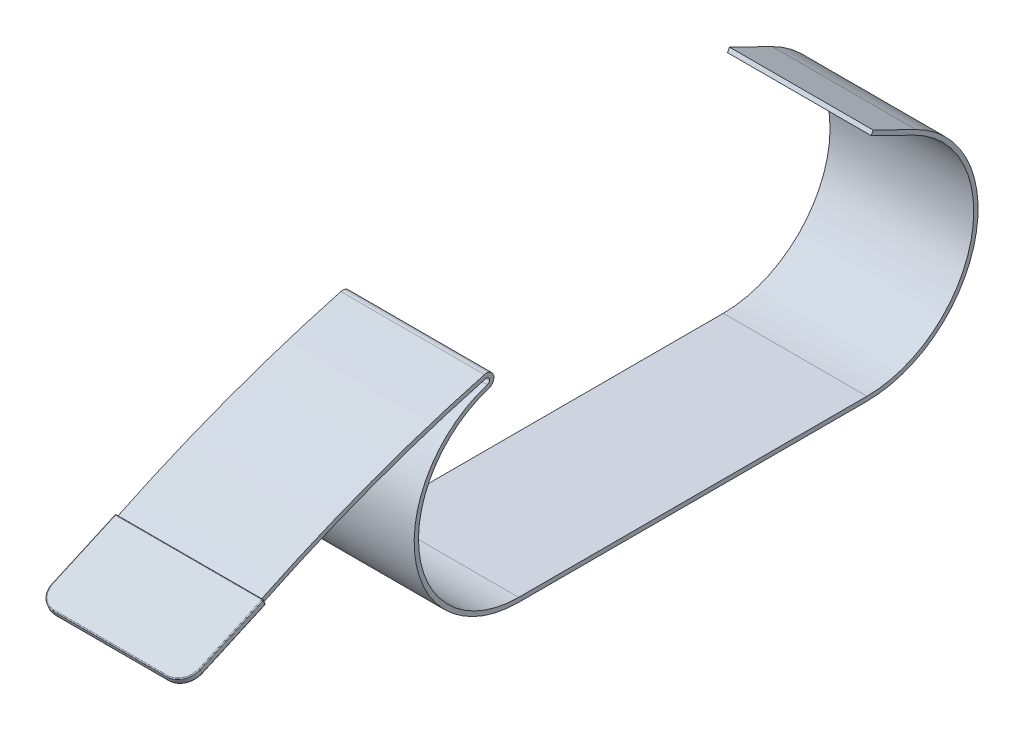
from build123d import *

# Parameters (mm, degrees)
BOSS_EXTRUDE1_DEPTH = 8.25
BOSS_EXTRUDE2_DEPTH = 8.5
FILLET2_R           = 2
CUT_EXTRUDE1_DEPTH  = 0.1
FILLET1_R           = 0.1


with BuildPart() as part:
    # Sketch1 → Boss-Extrude1 (new, symmetric)
    with BuildSketch(Plane(origin=(0, 0, 0), x_dir=(0, 0, -1), z_dir=(1, 0, 0))):
        with BuildLine():
            Line((-20, 0), (20, 0))
            ThreePointArc((20, 0), (31.94314613143427, 9.491936676512388), (25.392516821689124, 23.269630860737195))
            Line((25.392516821689124, 23.269630860737195), (20.48767915496346, 25.67194333522964))
            Line((20.48767915496346, 25.67194333522964), (20.707608671089492, 26.12097675039667))
            Line((20.707608671089492, 26.12097675039667), (25.612446337815154, 23.71866427590423))
            ThreePointArc((25.612446337815154, 23.71866427590423), (32.4302378618011, 9.379057775878826), (20, -0.5))
            Line((20, -0.5), (-20, -0.4999999999999987))
            ThreePointArc((-20, -0.4999999999999987), (-31.863566841643475, 9.685729623859952), (-23.590234900340555, 22.953935409328388))
            ThreePointArc((-23.590234900340555, 22.953935409328388), (-23.354479596787012, 23.394160454012642), (-23.789870300203464, 23.638728621400347))
            ThreePointArc((-23.789870300203464, 23.638728621400347), (-36.8961810366091, 19.4394741124151), (-49.55557214404263, 14.040498622612501))
            Line((-49.55557214404263, 14.040498622612501), (-49.77289846768594, 14.4907977110545))
            ThreePointArc((-49.77289846768594, 14.4907977110545), (-37.070723460551015, 19.908019672894), (-23.920118407045663, 24.1214660558966))
            ThreePointArc((-23.920118407045663, 24.1214660558966), (-22.874461521184195, 23.534098465627046), (-23.440663680772627, 22.47683117514367))
            ThreePointArc((-23.440663680772627, 22.47683117514367), (-31.36932392713061, 9.761386358218672), (-20, 0))
        make_face()
    extrude(amount=BOSS_EXTRUDE1_DEPTH, both=True)

    # Sketch2 → Boss-Extrude2 (add, symmetric)
    with BuildSketch(Plane(origin=(0, 0, 0), x_dir=(0, 0, -1), z_dir=(1, 0, 0))):
        Polygon((-49.26537752455312, 14.066353693944993), (-58.392962295280306, 9.981357212528026), (-58.67891204897949, 10.620288146478929), (-49.5513272782523, 14.705284627895898), align=None)
    extrude(amount=BOSS_EXTRUDE2_DEPTH, both=True)

    # Fillet2
    fillet2_edges = [part.edges().sort_by_distance(p)[0] for p in [
        (-8.5, 10.300822679503478, 58.5359371721299),
        (8.5, 10.300822679503478, 58.5359371721299),
    ]]
    fillet(fillet2_edges, radius=FILLET2_R)

    # Sketch3 → Cut-Extrude1 (cut)
    with BuildSketch(Plane(origin=(0, 30.088237033082944, 13.465812205476922), x_dir=(1, 0, 0), z_dir=(0, -0.9127584770727193, -0.40849964814169676))):
        with BuildLine():
            Line((-6.1992171672518035, 48.336758954326044), (6.1992171672518035, 48.336758954326044))
            ThreePointArc((6.1992171672518035, 48.336758954326044), (6.9063239484383585, 48.04386573551259), (7.199217167251811, 47.33675895432604))
            Line((7.199217167251811, 47.33675895432604), (7.199217167251811, 44.50945894575458))
            ThreePointArc((7.199217167251811, 44.50945894575458), (6.9063239484383585, 43.80235216456803), (6.1992171672518035, 43.509458945754574))
            Line((6.1992171672518035, 43.509458945754574), (-6.1992171672518035, 43.509458945754574))
            ThreePointArc((-6.1992171672518035, 43.509458945754574), (-6.9063239484383585, 43.80235216456803), (-7.199217167251811, 44.50945894575458))
            Line((-7.199217167251811, 44.50945894575458), (-7.199217167251811, 47.33675895432604))
            ThreePointArc((-7.199217167251811, 47.33675895432604), (-6.906323948438358, 48.04386573551259), (-6.1992171672518035, 48.336758954326044))
        make_face()
    extrude(amount=-CUT_EXTRUDE1_DEPTH, mode=Mode.SUBTRACT)

    # Fillet1
    # the kernel refuses this fillet: 0.1 mm, written as the material it takes off along each edge
    with BuildSketch(Plane(origin=(-8.4, 14.573158815374455, 49.601753161145396), x_dir=(-1, 0, 0), z_dir=(0, 0.9127584770727193, 0.40849964814169704))) as fillet1_piece_1_section:
        Polygon((0, 0), (FILLET1_R * 1.02, 0), (FILLET1_R * 1.02, -FILLET1_R * 1.02), (0, -FILLET1_R * 1.02), align=None)
    fillet1_piece_1 = extrude(amount=FILLET1_R * 1.02, mode=Mode.PRIVATE)
    fillet1_piece_1 = fillet1_piece_1 - Plane(origin=(-8.4, 14.573158815374455, 49.601753161145396), x_dir=(0.7071067811865475, -0.28885287131331006, 0.6454177087236268), z_dir=(0, 0.9127584770727193, 0.40849964814169704)) * Sphere(FILLET1_R, mode=Mode.PRIVATE)
    add(fillet1_piece_1, mode=Mode.SUBTRACT)
    with BuildSketch(Plane(origin=(-8.4, 14.116779576838097, 49.39750333707456), x_dir=(0, 0.4084996481416934, -0.912758477072721), z_dir=(-1, 0, 0))) as fillet1_piece_2_section:
        Polygon((0, 0), (FILLET1_R * 1.02, 0), (FILLET1_R * 1.02, FILLET1_R * 1.02), (3.9e-16, FILLET1_R * 1.02), align=None)
    fillet1_piece_2 = extrude(amount=FILLET1_R * 1.02, mode=Mode.PRIVATE)
    fillet1_piece_2 = fillet1_piece_2 - Plane(origin=(-8.4, 14.116779576838097, 49.39750333707456), x_dir=(0, 0.35656483741031497, 0.9342705800369375), z_dir=(-1, 0, 0)) * Sphere(FILLET1_R, mode=Mode.PRIVATE)
    add(fillet1_piece_2, mode=Mode.SUBTRACT)
    with BuildSketch(Plane(origin=(8.4, 14.116779576838095, 49.39750333707456), x_dir=(1, 0, 0), z_dir=(0, 0.4084996481416934, -0.912758477072721))) as fillet1_piece_3_section:
        Polygon((0, 0), (FILLET1_R * 1.02, 0), (FILLET1_R * 1.02, FILLET1_R * 1.02), (0, FILLET1_R * 1.02), align=None)
    fillet1_piece_3 = extrude(amount=FILLET1_R * 1.02, mode=Mode.PRIVATE)
    fillet1_piece_3 = fillet1_piece_3 - Plane(origin=(8.4, 14.116779576838095, 49.39750333707456), x_dir=(-0.7071067811865475, 0.6454177087236256, 0.2888528713133125), z_dir=(0, 0.4084996481416934, -0.912758477072721)) * Sphere(FILLET1_R, mode=Mode.PRIVATE)
    add(fillet1_piece_3, mode=Mode.SUBTRACT)
    with BuildSketch(Plane(origin=(8.4, 14.573158815374455, 49.601753161145396), x_dir=(0, 0.4084996481416934, -0.912758477072721), z_dir=(0, 0.9127584770727193, 0.40849964814169704))) as fillet1_piece_4_section:
        Polygon((0, 0), (FILLET1_R * 1.02, 0), (FILLET1_R * 1.02, -FILLET1_R * 1.02), (0, -FILLET1_R * 1.02), align=None)
    fillet1_piece_4 = extrude(amount=FILLET1_R * 1.02, mode=Mode.PRIVATE)
    fillet1_piece_4 = fillet1_piece_4 - Plane(origin=(8.4, 14.573158815374455, 49.601753161145396), x_dir=(-0.7071067811865475, -0.28885287131331006, 0.6454177087236268), z_dir=(0, 0.9127584770727193, 0.40849964814169704)) * Sphere(FILLET1_R, mode=Mode.PRIVATE)
    add(fillet1_piece_4, mode=Mode.SUBTRACT)
    with BuildSketch(Plane(origin=(-8.5, 11.43728744276232, 56.853395094834056), x_dir=(1, 0, 0), z_dir=(0, 0.40849964814169704, -0.9127584770727193))) as fillet1_piece_5:
        with BuildLine():
            CenterArc((FILLET1_R, FILLET1_R), FILLET1_R, 180, 90)
            Line((0, FILLET1_R), (0, 0))
            Line((0, 0), (FILLET1_R, 0))
        make_face()
    extrude(amount=7.900000000000008, mode=Mode.SUBTRACT)
    with BuildSketch(Plane(origin=(-8.5, 14.025503729130824, 49.35665337226039), x_dir=(0, 0.9127584770727193, 0.40849964814169687), z_dir=(0, -0.40849964814169687, 0.9127584770727193))) as fillet1_piece_6:
        with BuildLine():
            CenterArc((FILLET1_R, -FILLET1_R), FILLET1_R, 90, 90)
            Line((0, -FILLET1_R), (0, 0))
            Line((0, 0), (FILLET1_R, 0))
        make_face()
    extrude(amount=7.9, mode=Mode.SUBTRACT)
    with BuildSketch(Plane(origin=(-8.5, 14.614008780188621, 49.51047731343813), x_dir=(0, -0.40849964814169337, 0.9127584770727208), z_dir=(0, -0.912758477072721, -0.4084996481416934))) as fillet1_piece_7:
        with BuildLine():
            CenterArc((FILLET1_R, -FILLET1_R), FILLET1_R, 90, 90)
            Line((1.45e-15, -FILLET1_R), (0, 0))
            Line((0, 0), (FILLET1_R, 0))
        make_face()
    extrude(amount=0.4999999999999936, mode=Mode.SUBTRACT)
    with BuildSketch(Plane(origin=(6.5, 10.620288146478929, 58.67891204897949), x_dir=(0, 0.4084996481416779, -0.9127584770727277), z_dir=(-1, 0, 0))) as fillet1_piece_8:
        with BuildLine():
            CenterArc((FILLET1_R, FILLET1_R), FILLET1_R, 179.99999999999815, 89.99999999999955)
            Line((2.51e-15, FILLET1_R), (0, 0))
            Line((0, 0), (FILLET1_R, 0))
        make_face()
    extrude(amount=13, mode=Mode.SUBTRACT)
    with BuildSketch(Plane(origin=(6.5, 9.981357212528026, 58.392962295280306), x_dir=(0, 0.9127584770727145, 0.40849964814170747), z_dir=(-1, 0, 0))) as fillet1_piece_9:
        with BuildLine():
            CenterArc((FILLET1_R, FILLET1_R), FILLET1_R, 179.9999999999996, 90.00000000000131)
            Line((0, FILLET1_R), (0, 0))
            Line((0, 0), (FILLET1_R, 0))
        make_face()
    extrude(amount=13, mode=Mode.SUBTRACT)
    with BuildSketch(Plane(origin=(8.5, 14.025503729130824, 49.35665337226039), x_dir=(0, 0.9127584770727193, 0.40849964814169687), z_dir=(0, -0.40849964814169687, 0.9127584770727193))) as fillet1_piece_10:
        with BuildLine():
            CenterArc((FILLET1_R, FILLET1_R), FILLET1_R, 180, 90)
            Line((0, FILLET1_R), (0, 0))
            Line((0, 0), (FILLET1_R, 0))
        make_face()
    extrude(amount=7.9, mode=Mode.SUBTRACT)
    with BuildSketch(Plane(origin=(8.5, 11.43728744276232, 56.853395094834056), x_dir=(-1, 0, 0), z_dir=(0, 0.40849964814169704, -0.9127584770727193))) as fillet1_piece_11:
        with BuildLine():
            CenterArc((FILLET1_R, -FILLET1_R), FILLET1_R, 90, 90)
            Line((0, -FILLET1_R), (0, 0))
            Line((0, 0), (FILLET1_R, 0))
        make_face()
    extrude(amount=7.900000000000008, mode=Mode.SUBTRACT)
    with BuildSketch(Plane(origin=(8.5, 14.614008780188621, 49.51047731343813), x_dir=(-1, -5.93e-15, 1.325e-14), z_dir=(0, -0.912758477072721, -0.4084996481416934))) as fillet1_piece_12:
        with BuildLine():
            CenterArc((FILLET1_R, -FILLET1_R), FILLET1_R, 90.00000000000082, 89.99999999999918)
            Line((1.45e-15, -FILLET1_R), (0, 0))
            Line((0, 0), (FILLET1_R, 0))
        make_face()
    extrude(amount=0.499999999999992, mode=Mode.SUBTRACT)
    with BuildSketch(Plane(origin=(-8.4, 14.066353693944993, 49.26537752455312), x_dir=(0, 0.9127584770727116, 0.40849964814171413), z_dir=(1, 0, 0))) as fillet1_piece_13:
        with BuildLine():
            CenterArc((FILLET1_R, FILLET1_R), FILLET1_R, 180, 89.99999999999864)
            Line((2.35e-15, FILLET1_R), (0, 0))
            Line((0, 0), (FILLET1_R, 0))
        make_face()
    extrude(amount=16.799999999999997, mode=Mode.SUBTRACT)
    with BuildSketch(Plane(origin=(-8.4, 14.705284627895898, 49.5513272782523), x_dir=(0, -0.40849964814173395, 0.9127584770727026), z_dir=(1, 0, 0))) as fillet1_piece_14_section:
        with BuildLine():
            CenterArc((FILLET1_R, FILLET1_R), FILLET1_R, 179.99999999999554, 90.00000000000318)
            Line((-2.13e-15, FILLET1_R), (0, 0))
            Line((0, 0), (FILLET1_R, 0))
        make_face()
    fillet1_piece_14 = extrude(amount=16.799999999999997, mode=Mode.PRIVATE)
    fillet1_piece_14 = fillet1_piece_14 - Plane(origin=(-8.325000000000001, -119.19916199032235, -14.749433901316772), x_dir=(0, 0.9005981768840285, 0.4346526472865017), z_dir=(1, 0, 0)) * Cylinder(148.4457365480458, 35, mode=Mode.PRIVATE)
    add(fillet1_piece_14, mode=Mode.SUBTRACT)
    with BuildSketch(Plane(origin=(-8.4, 14.705284627895898, 49.5513272782523), x_dir=(0, -0.40849964814173395, 0.9127584770727026), z_dir=(1, 0, 0))) as fillet1_piece_15_section:
        with BuildLine():
            CenterArc((FILLET1_R, FILLET1_R), FILLET1_R, 179.99999999999554, 90.00000000000318)
            Line((-2.13e-15, FILLET1_R), (0, 0))
            Line((0, 0), (FILLET1_R, 0))
        make_face()
    fillet1_piece_15 = extrude(amount=16.799999999999997, mode=Mode.PRIVATE)
    fillet1_piece_15 = split(fillet1_piece_15, bisect_by=Plane(origin=(-8.25, 14.615931564484248, 49.51135087212141), z_dir=(-1, 0, 0)), keep=Keep.TOP, mode=Mode.PRIVATE)
    add(fillet1_piece_15, mode=Mode.SUBTRACT)
    with BuildSketch(Plane(origin=(-8.4, 14.705284627895898, 49.5513272782523), x_dir=(0, -0.40849964814173395, 0.9127584770727026), z_dir=(1, 0, 0))) as fillet1_piece_16_section:
        with BuildLine():
            CenterArc((FILLET1_R, FILLET1_R), FILLET1_R, 179.99999999999554, 90.00000000000318)
            Line((-2.13e-15, FILLET1_R), (0, 0))
            Line((0, 0), (FILLET1_R, 0))
        make_face()
    fillet1_piece_16 = extrude(amount=16.799999999999997, mode=Mode.PRIVATE)
    fillet1_piece_16 = split(fillet1_piece_16, bisect_by=Plane(origin=(8.25, 14.615931564484251, 49.51135087212142), z_dir=(1, 0, 0)), keep=Keep.TOP, mode=Mode.PRIVATE)
    add(fillet1_piece_16, mode=Mode.SUBTRACT)
    with BuildSketch(Plane(origin=(-6.5, 10.79835650881142, 56.56744534113487), x_dir=(-1, 0, 0), z_dir=(0, 0.40849964814169437, -0.9127584770727205))) as fillet1_piece_17:
        with BuildLine():
            CenterArc((2 - FILLET1_R, FILLET1_R), FILLET1_R, 270, 90)
            Line((2 - FILLET1_R, -4.52e-15), (2, 0))
            Line((2, 0), (2, FILLET1_R))
        make_face()
    revolve(axis=Axis((-6.5, 10.79835650881142, 56.56744534113487), (0, 0.9127584770727205, 0.40849964814169437)), revolution_arc=89.99999999999994, mode=Mode.SUBTRACT)
    with BuildSketch(Plane(origin=(6.5, 10.79835650881142, 56.56744534113487), x_dir=(1, 0, 0), z_dir=(0, 0.40849964814169437, -0.9127584770727205))) as fillet1_piece_18:
        with BuildLine():
            CenterArc((2 - FILLET1_R, -FILLET1_R), FILLET1_R, 0, 90)
            Line((2 - FILLET1_R, 4.52e-15), (2, 0))
            Line((2, 0), (2, -FILLET1_R))
        make_face()
    revolve(axis=Axis((6.5, 10.79835650881142, 56.56744534113487), (0, -0.9127584770727205, -0.40849964814169437)), revolution_arc=89.99999999999994, mode=Mode.SUBTRACT)
    with BuildSketch(Plane(origin=(-6.5, 11.437287442762319, 56.853395094834056), x_dir=(-1, 0, 0), z_dir=(0, 0.40849964814169437, -0.9127584770727205))) as fillet1_piece_19:
        with BuildLine():
            CenterArc((2 - FILLET1_R, -FILLET1_R), FILLET1_R, 359.99999999999835, 90.00000000000165)
            Line((2, -FILLET1_R), (2, 0))
            Line((2, 0), (2 - FILLET1_R, 1.62e-15))
        make_face()
    revolve(axis=Axis((-6.5, 11.437287442762319, 56.853395094834056), (0, 0.9127584770727205, 0.40849964814169437)), revolution_arc=90, mode=Mode.SUBTRACT)
    with BuildSketch(Plane(origin=(6.5, 11.437287442762319, 56.853395094834056), x_dir=(1, 0, 0), z_dir=(0, 0.40849964814169437, -0.9127584770727205))) as fillet1_piece_20:
        with BuildLine():
            CenterArc((2 - FILLET1_R, FILLET1_R), FILLET1_R, 270, 90.00000000000166)
            Line((2, FILLET1_R), (2, 0))
            Line((2, 0), (2 - FILLET1_R, -1.62e-15))
        make_face()
    revolve(axis=Axis((6.5, 11.437287442762319, 56.853395094834056), (0, -0.9127584770727205, -0.40849964814169437)), revolution_arc=90, mode=Mode.SUBTRACT)
    with BuildSketch(Plane(origin=(7.199217167251811, 10.751187656072442, 56.67284021818597), x_dir=(1, -1.3009e-13, -5.822e-14), z_dir=(0, 0.4084996481416968, -0.9127584770727194))) as fillet1_piece_21:
        with BuildLine():
            CenterArc((FILLET1_R, -FILLET1_R), FILLET1_R, 89.99999999999183, 90.00000000000465)
            Line((-1.425e-14, -FILLET1_R), (0, 0))
            Line((0, 0), (FILLET1_R, 0))
        make_face()
    extrude(amount=2.827300008571454, mode=Mode.SUBTRACT)
    with BuildSketch(Plane(origin=(6.199217167251807, 11.9061387147649, 54.092198168134594), x_dir=(1, -3.55e-15, 7.11e-15), z_dir=(-7.936821341612911e-15, -0.4084996481416968, 0.9127584770727194))) as fillet1_piece_22:
        with BuildLine():
            CenterArc((1.0000000000000018 + FILLET1_R, FILLET1_R), FILLET1_R, 179.99999999999, 90.00000000001)
            Line((1.0000000000000018, FILLET1_R), (1.0000000000000018, 0))
            Line((1.0000000000000018, 0), (1.0000000000000018 + FILLET1_R, -1.422e-14))
        make_face()
    revolve(axis=Axis((6.199217167251807, 11.9061387147649, 54.092198168134594), (0, 0.9127584770727194, 0.4084996481416968)), revolution_arc=90.00000000000061, mode=Mode.SUBTRACT)
    with BuildSketch(Plane(origin=(6.1992171672518035, 12.3146383629066, 53.17943969106187), x_dir=(0, 0.4084996481415774, -0.9127584770727728), z_dir=(-1, 0, 0))) as fillet1_piece_23:
        with BuildLine():
            CenterArc((FILLET1_R, -FILLET1_R), FILLET1_R, 89.99999999999143, 90.00000000001319)
            Line((-1.135e-14, -FILLET1_R), (0, 0))
            Line((0, 0), (FILLET1_R, 0))
        make_face()
    extrude(amount=12.398434334503607, mode=Mode.SUBTRACT)
    with BuildSketch(Plane(origin=(-6.199217167251807, 11.9061387147649, 54.092198168134594), x_dir=(3.5527136788004915e-15, 0.40849964814169826, -0.9127584770727186), z_dir=(1, -1.45e-15, 3.24e-15))) as fillet1_piece_24:
        with BuildLine():
            CenterArc((1.0000000000000027 + FILLET1_R, FILLET1_R), FILLET1_R, 179.9999999999887, 90.00000000001234)
            Line((1.0000000000000038, FILLET1_R), (1.0000000000000027, 0))
            Line((1.0000000000000027, 0), (1.0000000000000027 + FILLET1_R, -1.323e-14))
        make_face()
    revolve(axis=Axis((-6.199217167251807, 11.9061387147649, 54.092198168134594), (0, 0.9127584770727194, 0.4084996481416968)), revolution_arc=90.00000000000061, mode=Mode.SUBTRACT)
    with BuildSketch(Plane(origin=(-7.199217167251811, 11.906138714764896, 54.0921981681346), x_dir=(-1, -1.3009e-13, -5.822e-14), z_dir=(0, -0.4084996481416968, 0.9127584770727194))) as fillet1_piece_25:
        with BuildLine():
            CenterArc((FILLET1_R, -FILLET1_R), FILLET1_R, 89.99999999999183, 90.0000000000091)
            Line((-1.425e-14, -FILLET1_R), (0, 0))
            Line((0, 0), (FILLET1_R, 0))
        make_face()
    extrude(amount=2.827300008571454, mode=Mode.SUBTRACT)
    with BuildSketch(Plane(origin=(-6.199217167251806, 10.751187656072442, 56.67284021818597), x_dir=(-1, 0, 0), z_dir=(0, 0.4084996481416968, -0.9127584770727194))) as fillet1_piece_26:
        with BuildLine():
            CenterArc((1.0000000000000062 + FILLET1_R, FILLET1_R), FILLET1_R, 179.99999999999537, 90.00000000000466)
            Line((1.0000000000000062, FILLET1_R), (1.0000000000000062, 0))
            Line((1.0000000000000062, 0), (1.0000000000000062 + FILLET1_R, -1.425e-14))
        make_face()
    revolve(axis=Axis((-6.199217167251806, 10.751187656072442, 56.67284021818597), (0, 0.9127584770727194, 0.4084996481416968)), revolution_arc=90.00000000000016, mode=Mode.SUBTRACT)
    with BuildSketch(Plane(origin=(-6.1992171672518035, 10.342688007930743, 57.585598695258696), x_dir=(0, -0.40849964814183753, 0.9127584770726563), z_dir=(1, 0, 0))) as fillet1_piece_27:
        with BuildLine():
            CenterArc((FILLET1_R, -FILLET1_R), FILLET1_R, 89.99999999999226, 90.00000000001148)
            Line((-1.642e-14, -FILLET1_R), (0, 0))
            Line((0, 0), (FILLET1_R, 0))
        make_face()
    extrude(amount=12.398434334503607, mode=Mode.SUBTRACT)
    with BuildSketch(Plane(origin=(6.199217167251807, 10.751187656072439, 56.672840218185975), x_dir=(-3.552713678800497e-15, -0.40849964814169537, 0.9127584770727201), z_dir=(-1, 1.45e-15, -3.24e-15))) as fillet1_piece_28:
        with BuildLine():
            CenterArc((1.0000000000000013 + FILLET1_R, FILLET1_R), FILLET1_R, 179.99999999998826, 90.00000000001057)
            Line((1.000000000000001, FILLET1_R), (1.0000000000000013, -2e-17))
            Line((1.0000000000000013, -2e-17), (1.0000000000000013 + FILLET1_R, -1.557e-14))
        make_face()
    revolve(axis=Axis((6.199217167251807, 10.751187656072439, 56.672840218185975), (0, 0.9127584770727194, 0.4084996481416968)), revolution_arc=90.00000000000061, mode=Mode.SUBTRACT)


solid = part.part
